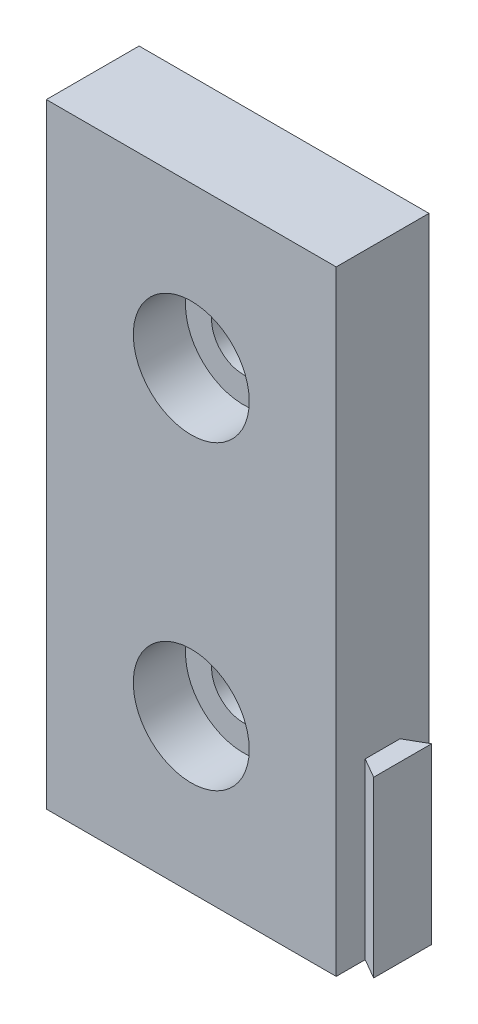
from build123d import *

# Parameters (mm, degrees)
SKETCH2_W           = 25
SKETCH2_H           = 53
SKETCH2_R           = 2.75
BOSS_EXTRUDE1_DEPTH = 8
BOSS_EXTRUDE2_DEPTH = 15
SKETCH4_R           = 5
CUT_EXTRUDE1_DEPTH  = 4.5


with BuildPart() as part:
    # Sketch2 → Boss-Extrude1 (new body)
    with BuildSketch(Plane.XY):
        with Locations((12.5, 26.5)):
            Rectangle(SKETCH2_W, SKETCH2_H)
        with Locations((12.5, 39.2)):
            Circle(SKETCH2_R, mode=Mode.SUBTRACT)
        with Locations((12.5, 13.2)):
            Circle(SKETCH2_R, mode=Mode.SUBTRACT)
    extrude(amount=BOSS_EXTRUDE1_DEPTH)

    # Sketch3 → Boss-Extrude2 (add)
    with BuildSketch(Plane.XZ):
        Polygon((25, 2.5), (26.732050808, 1.5), (26.732050808, 6.5), (25, 5.5), align=None)
    extrude(amount=-BOSS_EXTRUDE2_DEPTH)

    # Sketch4 → Cut-Extrude1 (cut)
    with BuildSketch(Plane.XY.offset(8)):
        with Locations((12.5, 39.2)):
            Circle(SKETCH4_R)
        with Locations((12.5, 13.2)):
            Circle(SKETCH4_R)
    extrude(amount=-CUT_EXTRUDE1_DEPTH, mode=Mode.SUBTRACT)


solid = part.part
